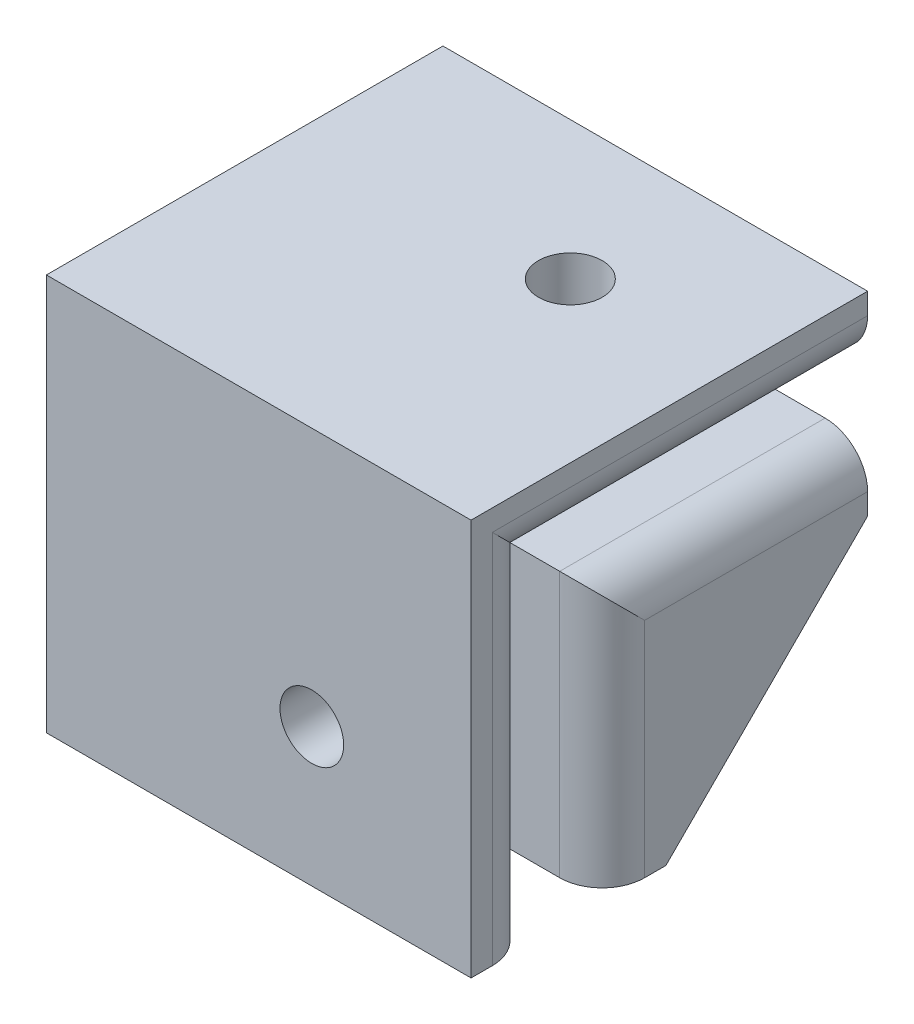
from build123d import *

# Parameters (mm, degrees)
BOSS_EXTRUDE1_DEPTH = 20
CUT_EXTRUDE1_DEPTH  = 15
FILLET1_R           = 2
SKETCH3_R           = 1.5
CUT_EXTRUDE2_DEPTH  = 31.083311404
SKETCH4_R           = 1.5
CUT_EXTRUDE3_DEPTH  = 31.083311404


with BuildPart() as part:
    # Sketch1 → Boss-Extrude1 (new body)
    with BuildSketch(Plane(origin=(0, 0, 0), x_dir=(0, 0, -1), z_dir=(1, 0, 0))):
        Polygon((0, -12.5), (-3.175, -12.5), (-6.175, -12.5), (-6.175, 6.175), (12.5, 6.175), (12.5, 3.175), (12.5, 0), (12.5, -3), (3, -12.5), align=None)
    extrude(amount=BOSS_EXTRUDE1_DEPTH)

    # Sketch2 → Cut-Extrude1 (cut)
    with BuildSketch(Plane(origin=(20, 0, 0), x_dir=(0, 0, -1), z_dir=(1, 0, 0))):
        Polygon((-3.175, -12.5), (0, -12.5), (0, 0), (12.5, 0), (12.5, 3.175), (-3.175, 3.175), align=None)
    extrude(amount=-CUT_EXTRUDE1_DEPTH, mode=Mode.SUBTRACT)

    # Fillet1
    fillet1_edges = [part.edges().sort_by_distance(p)[0] for p in [
        (20, -4.6625, 3.175),
        (20, -6.25, 0),
        (20, 0, -6.25),
        (20, 3.175, -4.6625),
    ]]
    fillet(fillet1_edges, radius=FILLET1_R)

    # Sketch3 → Cut-Extrude2 (cut, through all)
    with BuildSketch(Plane(origin=(0, 6.175, 0), x_dir=(1, 0, 0), z_dir=(0, 1, 0))):
        with Locations((12.5, 6)):
            Circle(SKETCH3_R)
    extrude(amount=-CUT_EXTRUDE2_DEPTH, mode=Mode.SUBTRACT)

    # Sketch4 → Cut-Extrude3 (cut, through all)
    with BuildSketch(Plane.XY.offset(6.175)):
        with Locations((12.5, -6)):
            Circle(SKETCH4_R)
    extrude(amount=-CUT_EXTRUDE3_DEPTH, mode=Mode.SUBTRACT)


solid = part.part
